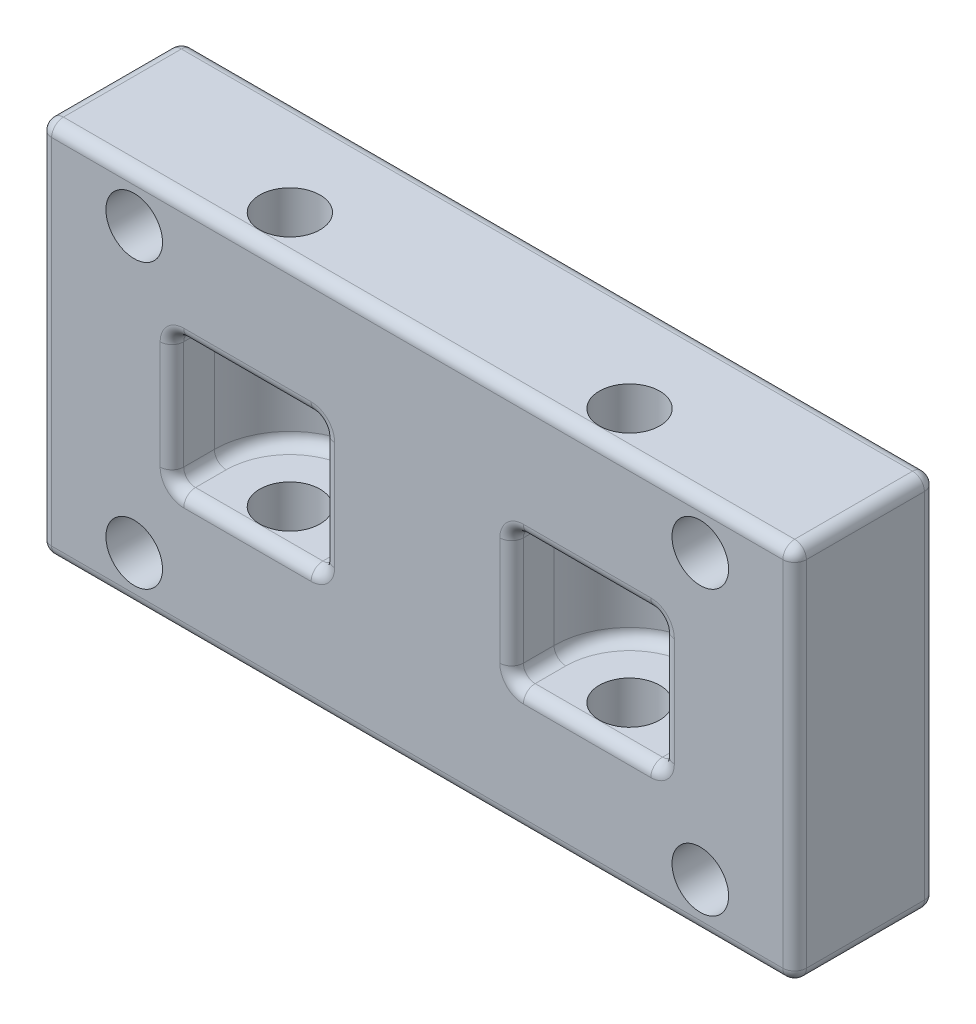
from build123d import *

# Parameters (mm, degrees)
SKETCH1_W               = 50.8
SKETCH1_H               = 25.4
BOSS_EXTRUDE1_DEPTH     = 9.525
SKETCH2_R               = 1.905
CUT_EXTRUDE1_DEPTH      = 58.589283942
CUT_EXTRUDE2_DEPTH      = 4.445
SKETCH5_R               = 2.032
CUT_EXTRUDE3_DEPTH      = 58.589283942
MIRROR2_COPY_1_SKETCH_R = 1.905
MIRROR2_COPY_1_DEPTH    = 58.589283942
FILLET1_R               = 0.79375
SKETCH7_R               = 1.905
CUT_EXTRUDE4_DEPTH      = 7.62


with BuildPart() as part:
    # Sketch1 → Boss-Extrude1 (new body)
    with BuildSketch(Plane.XY):
        with Locations((25.4, 12.7)):
            Rectangle(SKETCH1_W, SKETCH1_H)
    extrude(amount=BOSS_EXTRUDE1_DEPTH)

    # Sketch2 → Cut-Extrude1 (cut, through all)
    with BuildSketch(Plane.XY.offset(9.525)):
        with Locations((6.35, 22.225)):
            Circle(SKETCH2_R)
    cut_extrude1 = extrude(amount=-CUT_EXTRUDE1_DEPTH, mode=Mode.SUBTRACT)

    # Sketch4 → Cut-Extrude2 (cut, symmetric)
    with BuildSketch(Plane(origin=(0, 12.7, 0), x_dir=(1, 0, 0), z_dir=(0, 1, 0))):
        with BuildLine():
            Line((8.89, -6.6675), (8.89, -9.525))
            Line((8.89, -9.525), (19.05, -9.525))
            Line((19.05, -9.525), (19.05, -6.6675))
            ThreePointArc((19.05, -6.6675), (13.97, -1.5875), (8.89, -6.6675))
        make_face()
    cut_extrude2 = extrude(amount=CUT_EXTRUDE2_DEPTH, both=True, mode=Mode.SUBTRACT)

    # Sketch5 → Cut-Extrude3 (cut, through all)
    with BuildSketch(Plane(origin=(0, 25.4, 0), x_dir=(1, 0, 0), z_dir=(0, 1, 0))):
        with Locations((13.97, -6.6675)):
            Circle(SKETCH5_R)
    cut_extrude3 = extrude(amount=-CUT_EXTRUDE3_DEPTH, mode=Mode.SUBTRACT)

    # Mirror1: Cut-Extrude1 across plane
    add(cut_extrude1.mirror(Plane.ZX.offset(12.7)), mode=Mode.SUBTRACT)

    # Mirror2: Cut-Extrude1, Cut-Extrude2, Cut-Extrude3 across plane
    add(cut_extrude1.mirror(Plane(origin=(25.4, 0, 0), x_dir=(0, 0, 1), z_dir=(1, 0, 0))), mode=Mode.SUBTRACT)
    add(cut_extrude2.mirror(Plane(origin=(25.4, 0, 0), x_dir=(0, 0, 1), z_dir=(1, 0, 0))), mode=Mode.SUBTRACT)
    add(cut_extrude3.mirror(Plane(origin=(25.4, 0, 0), x_dir=(0, 0, 1), z_dir=(1, 0, 0))), mode=Mode.SUBTRACT)

    # Mirror2 copy 1 sketch → Mirror2 copy 1 (cut, through all)
    with BuildSketch(Plane(origin=(50.8, 25.4, 9.525), x_dir=(-1, 0, 0), z_dir=(0, 0, 1))):
        with Locations((6.35, 22.225)):
            Circle(MIRROR2_COPY_1_SKETCH_R)
    extrude(amount=-MIRROR2_COPY_1_DEPTH, mode=Mode.SUBTRACT)

    # Fillet1
    fillet1_edges = [part.edges().sort_by_distance(p)[0] for p in [
        (31.75, 8.255, 8.09625),
        (41.91, 8.255, 8.09625),
        (31.75, 17.145, 8.09625),
        (41.91, 17.145, 8.09625),
        (19.05, 8.255, 8.09625),
        (8.89, 8.255, 8.09625),
        (19.05, 17.145, 8.09625),
        (8.89, 17.145, 8.09625),
        (36.83, 8.255, 1.5875),
        (36.83, 17.145, 1.5875),
        (13.97, 8.255, 1.5875),
        (13.97, 17.145, 1.5875),
        (0, 25.4, 4.7625),
        (0, 12.7, 9.525),
        (0, 0, 4.7625),
        (0, 12.7, 0),
        (50.8, 0, 4.7625),
        (50.8, 12.7, 9.525),
        (50.8, 25.4, 4.7625),
        (50.8, 12.7, 0),
        (8.89, 12.7, 9.525),
        (13.97, 8.255, 9.525),
        (19.05, 12.7, 9.525),
        (13.97, 17.145, 9.525),
        (36.83, 17.145, 9.525),
        (36.83, 8.255, 9.525),
        (31.75, 12.7, 9.525),
        (41.91, 12.7, 9.525),
        (25.4, 25.4, 9.525),
        (25.4, 0, 9.525),
        (25.4, 0, 0),
        (25.4, 25.4, 0),
    ]]
    fillet(fillet1_edges, radius=FILLET1_R)

    # Sketch7 → Cut-Extrude4 (cut)
    with BuildSketch(Plane(origin=(0, 0, 0), x_dir=(-1, 0, 0), z_dir=(0, 0, -1))):
        with Locations((-31.75, 19.05)):
            Circle(SKETCH7_R)
        with Locations((-31.75, 6.35)):
            Circle(SKETCH7_R)
        with Locations((-19.05, 19.05)):
            Circle(SKETCH7_R)
        with Locations((-19.05, 6.35)):
            Circle(SKETCH7_R)
    extrude(amount=-CUT_EXTRUDE4_DEPTH, mode=Mode.SUBTRACT)


solid = part.part
